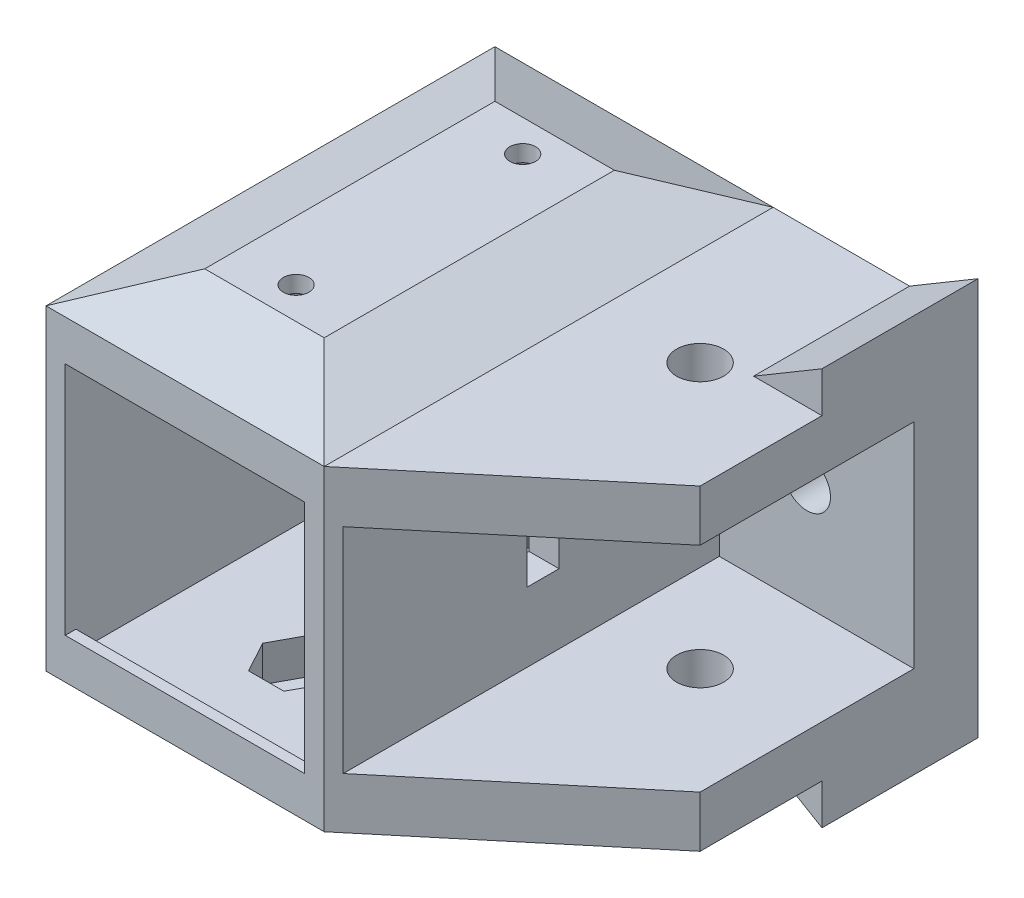
from build123d import *
from OCP.BRepFilletAPI import BRepFilletAPI_MakeChamfer

# Parameters (mm, degrees)
SKETCH1_R                  = 2.2
SKETCH1_W                  = 22.4
SKETCH1_H                  = 25.8
BOSS_EXTRUDE1_DEPTH        = 42
CUT_EXTRUDE1_DEPTH         = 69.433909723
BOSS_EXTRUDE2_DEPTH        = 14.6
SKETCH4_W                  = 36
SKETCH4_H                  = 20
CUT_EXTRUDE2_DEPTH         = 18.2
SKETCH5_R                  = 2.2
CUT_EXTRUDE3_DEPTH         = 71.161242862
SKETCH16_W                 = 26.03
SKETCH16_H                 = 42
BOSS_EXTRUDE6_DEPTH        = 3
CHAMFER1_SIZE              = 7.42526056
CHAMFER1_SIZE_2            = 3
CHAMFER1_OF_MIRROR7_SIZE   = 7.42526056
CHAMFER1_OF_MIRROR7_SIZE_2 = 3
CUT_EXTRUDE4_START         = -1.9
CUT_EXTRUDE4_DEPTH         = 3.35
SKETCH10_R                 = 1.2
CUT_EXTRUDE10_DEPTH        = 72.637978754
SKETCH13_W                 = 22.4
SKETCH13_H                 = 1.9
BOSS_EXTRUDE4_DEPTH        = 1
SKETCH14_W                 = 3
SKETCH14_H                 = 7
CUT_EXTRUDE11_DEPTH        = 2.8
SKETCH15_W                 = 22.4
SKETCH15_H                 = 1.9
BOSS_EXTRUDE5_DEPTH        = 1
MIRROR5_START              = -1.9
MIRROR5_COPY_1_DEPTH       = 3.35
SKETCH17_W                 = 13.216816462
SKETCH17_H                 = 5
SKETCH17_W_2               = 8
BOSS_EXTRUDE7_DEPTH        = 3.2
FILLET1_SIZE               = 3
FILLET1_SIZE_2             = 18
FILLET3_SIZE               = 5
FILLET3_SIZE_2             = 4


# Some blends are built 0.0001 mm under size
with BuildPart() as part:
    # Sketch1 → Boss-Extrude1 (new body)
    with BuildSketch(Plane.XY):
        Polygon((2, 0), (45.2, 0), (45.2, 29.6), (2, 29.6), (0, 29.6), (0, 27.6), (0, 2), (0, 0), align=None)
        with Locations(Location((35.2, 14.8, 0), (0, 0, 180))):
            Circle(SKETCH1_R, mode=Mode.SUBTRACT)
        with Locations((13, 14.8)):
            Rectangle(SKETCH1_W, SKETCH1_H, mode=Mode.SUBTRACT)
    extrude(amount=BOSS_EXTRUDE1_DEPTH)

    # Sketch2 → Cut-Extrude1 (cut, through all)
    with BuildSketch(Plane(origin=(0, 29.6, 0), x_dir=(1, 0, 0), z_dir=(0, 1, 0))):
        Polygon((45.2, -26), (26.03, -42), (45.2, -42), align=None)
    extrude(amount=-CUT_EXTRUDE1_DEPTH, mode=Mode.SUBTRACT)

    # Sketch3 → Boss-Extrude2 (add)
    with BuildSketch(Plane(origin=(0, 0, 0), x_dir=(-1, 0, 0), z_dir=(0, 0, -1))):
        Polygon((-38.8, 0), (-45.2, -3.8), (-45.2, 0), align=None)
        Polygon((-45.2, 29.6), (-38.8, 29.6), (-45.2, 33.4), align=None)
    extrude(amount=-BOSS_EXTRUDE2_DEPTH)

    # Sketch4 → Cut-Extrude2 (cut)
    with BuildSketch(Plane(origin=(45.2, 0, 0), x_dir=(0, 0, -1), z_dir=(1, 0, 0))):
        with Locations((-24, 14.8)):
            Rectangle(SKETCH4_W, SKETCH4_H)
    extrude(amount=-CUT_EXTRUDE2_DEPTH, mode=Mode.SUBTRACT)

    # Sketch5 → Cut-Extrude3 (cut, through all)
    with BuildSketch(Plane(origin=(0, 29.6, 0), x_dir=(1, 0, 0), z_dir=(0, 1, 0))):
        with Locations(Location((35.2, -16, 0), (0, 0, 270))):
            Circle(SKETCH5_R)
    extrude(amount=-CUT_EXTRUDE3_DEPTH, mode=Mode.SUBTRACT)

    # Sketch16 → Boss-Extrude6 (add)
    with BuildSketch(Plane(origin=(0, 29.6, 0), x_dir=(1, 0, 0), z_dir=(0, 1, 0))):
        with Locations((13.015, -21)):
            Rectangle(SKETCH16_W, SKETCH16_H)
    boss_extrude6 = extrude(amount=BOSS_EXTRUDE6_DEPTH)

    # Chamfer1
    chamfer1_edges_1 = [part.edges().sort_by_distance(p)[0] for p in [
        (13.015, 32.6, 42),
    ]]
    chamfer1_side_1 = [part.faces().sort_by_distance(p)[0] for p in [
        (13.015, 32.6, 41.94),
    ]]
    chamfer1_edges_2 = [part.edges().sort_by_distance(p)[0] for p in [
        (26.03, 32.6, 21),
    ]]
    chamfer1_side_2 = [part.faces().sort_by_distance(p)[0] for p in [
        (26.03, 32.54, 21),
    ]]
    chamfer1_edges_3 = [part.edges().sort_by_distance(p)[0] for p in [
        (13.015, 32.6, 0),
    ]]
    chamfer1_side_3 = [part.faces().sort_by_distance(p)[0] for p in [
        (13.015, 32.6, 0.06),
    ]]
    chamfer1_edges_4 = [part.edges().sort_by_distance(p)[0] for p in [
        (0, 32.6, 21),
    ]]
    chamfer1_side_4 = [part.faces().sort_by_distance(p)[0] for p in [
        (0.06, 32.6, 21),
    ]]
    chamfer1 = BRepFilletAPI_MakeChamfer(part.part.solid().wrapped)
    for e in chamfer1_edges_1:
        chamfer1.Add(CHAMFER1_SIZE - 0.0001, CHAMFER1_SIZE_2 - 0.0001, e.wrapped, chamfer1_side_1[0].wrapped)
    for e in chamfer1_edges_2:
        chamfer1.Add(CHAMFER1_SIZE_2 - 0.0001, CHAMFER1_SIZE - 0.0001, e.wrapped, chamfer1_side_2[0].wrapped)
    for e in chamfer1_edges_3:
        chamfer1.Add(CHAMFER1_SIZE - 0.0001, CHAMFER1_SIZE_2 - 0.0001, e.wrapped, chamfer1_side_3[0].wrapped)
    for e in chamfer1_edges_4:
        chamfer1.Add(CHAMFER1_SIZE - 0.0001, CHAMFER1_SIZE_2 - 0.0001, e.wrapped, chamfer1_side_4[0].wrapped)
    add(Compound.cast(chamfer1.Shape()), mode=Mode.REPLACE)  # a hair under: the kernel refuses the full size

    # Mirror7: Boss-Extrude6 across plane
    add(boss_extrude6.mirror(Plane(origin=(0, 14.8, 0), x_dir=(0, 0, 1), z_dir=(0, -1, 0))))

    # Chamfer1 of Mirror7
    chamfer1_of_mirror7_edges_1 = [part.edges().sort_by_distance(p)[0] for p in [
        (13.015, -3, 42),
    ]]
    chamfer1_of_mirror7_side_1 = [part.faces().sort_by_distance(p)[0] for p in [
        (13.015, -3, 41.94),
    ]]
    chamfer1_of_mirror7_edges_2 = [part.edges().sort_by_distance(p)[0] for p in [
        (26.03, -3, 21),
    ]]
    chamfer1_of_mirror7_side_2 = [part.faces().sort_by_distance(p)[0] for p in [
        (26.03, -2.94, 21),
    ]]
    chamfer1_of_mirror7_edges_3 = [part.edges().sort_by_distance(p)[0] for p in [
        (13.015, -3, 0),
    ]]
    chamfer1_of_mirror7_side_3 = [part.faces().sort_by_distance(p)[0] for p in [
        (13.015, -2.94, 0),
    ]]
    chamfer1_of_mirror7_edges_4 = [part.edges().sort_by_distance(p)[0] for p in [
        (0, -3, 21),
    ]]
    chamfer1_of_mirror7_side_4 = [part.faces().sort_by_distance(p)[0] for p in [
        (0.06, -3, 21),
    ]]
    chamfer1_of_mirror7 = BRepFilletAPI_MakeChamfer(part.part.solid().wrapped)
    for e in chamfer1_of_mirror7_edges_1:
        chamfer1_of_mirror7.Add(CHAMFER1_OF_MIRROR7_SIZE - 0.0001, CHAMFER1_OF_MIRROR7_SIZE_2 - 0.0001, e.wrapped, chamfer1_of_mirror7_side_1[0].wrapped)
    for e in chamfer1_of_mirror7_edges_2:
        chamfer1_of_mirror7.Add(CHAMFER1_OF_MIRROR7_SIZE_2 - 0.0001, CHAMFER1_OF_MIRROR7_SIZE - 0.0001, e.wrapped, chamfer1_of_mirror7_side_2[0].wrapped)
    for e in chamfer1_of_mirror7_edges_3:
        chamfer1_of_mirror7.Add(CHAMFER1_OF_MIRROR7_SIZE_2 - 0.0001, CHAMFER1_OF_MIRROR7_SIZE - 0.0001, e.wrapped, chamfer1_of_mirror7_side_3[0].wrapped)
    for e in chamfer1_of_mirror7_edges_4:
        chamfer1_of_mirror7.Add(CHAMFER1_OF_MIRROR7_SIZE - 0.0001, CHAMFER1_OF_MIRROR7_SIZE_2 - 0.0001, e.wrapped, chamfer1_of_mirror7_side_4[0].wrapped)
    add(Compound.cast(chamfer1_of_mirror7.Shape()), mode=Mode.REPLACE)  # a hair under: the kernel refuses the full size

    # Sketch6 → Cut-Extrude4 (cut)
    with BuildSketch(Plane(origin=(0, 29.6, 0), x_dir=(1, 0, 0), z_dir=(0, 1, 0)).offset(CUT_EXTRUDE4_START)):
        Polygon((11.35, -13.4), (9.775198425, -10.5), (11.35, -7.6), (14.65, -7.6), (16.244163906, -10.5), (14.65, -13.4), align=None)
    cut_extrude4 = extrude(amount=CUT_EXTRUDE4_DEPTH, mode=Mode.SUBTRACT)

    # Sketch10 → Cut-Extrude10 (cut, through all)
    with BuildSketch(Plane(origin=(0, 32.6, 0), x_dir=(1, 0, 0), z_dir=(0, 1, 0))):
        with Locations(Location((13, -10.4, 0), (0, 0, 270))):
            Circle(SKETCH10_R)
    cut_extrude10 = extrude(amount=-CUT_EXTRUDE10_DEPTH, mode=Mode.SUBTRACT)

    # Mirror4: Cut-Extrude4 across plane
    add(cut_extrude4.mirror(Plane(origin=(0, 14.8, 0), x_dir=(0, 0, 1), z_dir=(0, -1, 0))), mode=Mode.SUBTRACT)

    # Sketch13 → Boss-Extrude4 (add)
    with BuildSketch(Plane.XY.offset(42)):
        with Locations((13, 2.85)):
            Rectangle(SKETCH13_W, SKETCH13_H)
        with Locations((13, 26.75)):
            Rectangle(SKETCH13_W, SKETCH13_H)
    extrude(amount=-BOSS_EXTRUDE4_DEPTH)

    # Sketch14 → Cut-Extrude11 (cut)
    with BuildSketch(Plane(origin=(27, 0, 0), x_dir=(0, 0, -1), z_dir=(1, 0, 0))):
        with Locations((-9.5, 14.8)):
            Rectangle(SKETCH14_W, SKETCH14_H)
        with Locations((-22.5, 14.8)):
            Rectangle(SKETCH14_W, SKETCH14_H)
    extrude(amount=-CUT_EXTRUDE11_DEPTH, mode=Mode.SUBTRACT)

    # Sketch15 → Boss-Extrude5 (add)
    with BuildSketch(Plane(origin=(0, 0, 0), x_dir=(-1, 0, 0), z_dir=(0, 0, -1))):
        with Locations((-13, 2.85)):
            Rectangle(SKETCH15_W, SKETCH15_H)
        with Locations((-13, 26.75)):
            Rectangle(SKETCH15_W, SKETCH15_H)
    extrude(amount=-BOSS_EXTRUDE5_DEPTH)

    # Mirror5: Cut-Extrude4, Cut-Extrude10 across plane
    add(cut_extrude4.mirror(Plane.XY.offset(21)), mode=Mode.SUBTRACT)
    add(cut_extrude10.mirror(Plane.XY.offset(21)), mode=Mode.SUBTRACT)

    # Mirror5 copy 1 sketch → Mirror5 copy 1 (cut)
    with BuildSketch(Plane(origin=(0, 0, 42), x_dir=(1, 0, 0), z_dir=(0, -1, 0)).offset(MIRROR5_START)):
        Polygon((11.35, -13.4), (9.775198425, -10.5), (11.35, -7.6), (14.65, -7.6), (16.244163906, -10.5), (14.65, -13.4), align=None)
    extrude(amount=MIRROR5_COPY_1_DEPTH, mode=Mode.SUBTRACT)

    # Sketch17 → Boss-Extrude7 (add)
    with BuildSketch(Plane.ZY.offset(-24.2)):
        with Locations((30.608408231, 14.8)):
            Rectangle(SKETCH17_W, SKETCH17_H)
        with Locations((4, 14.8)):
            Rectangle(SKETCH17_W_2, SKETCH17_H)
    extrude(amount=BOSS_EXTRUDE7_DEPTH)

    # Fillet1
    # a fillet whose section is not a circle: 18, 3 mm, written as the material it takes off along each edge
    with BuildSketch(Plane(origin=(21, 12.3, 24), x_dir=(1, 0, 0), z_dir=(0, 1, 0))) as fillet1_piece_1:
        with BuildLine():
            Bezier((FILLET1_SIZE, 0), (0, 0), (0, -FILLET1_SIZE_2), weights=[1, 0.538461538, 1])
            Line((0, -FILLET1_SIZE_2), (0, 0))
            Line((0, 0), (FILLET1_SIZE, 0))
        make_face()
    extrude(amount=5, mode=Mode.SUBTRACT)

    # Fillet2
    # a fillet whose section is not a circle: 1 mm, written as the material it takes off along each edge
    with BuildSketch(Plane(origin=(21.159285498, 19.997028117, 37.216816462), x_dir=(1, 0, 0), z_dir=(0, -1, 0))) as fillet2_piece_1:
        with BuildLine():
            Bezier((1.072400011, 0), (-0.006916058, 0), (0.075305906, -1.076179691), weights=[1, 1, 1])
            ThreePointArc((0.075305906, -1.076179691), (0.035933118, -0.538210194), (0, 0))
            Line((0, 0), (1.072400011, 0))
        make_face()
    extrude(amount=10.394056235, mode=Mode.SUBTRACT)

    # Fillet3
    # a fillet whose section is not a circle: 5, 4 mm, written as the material it takes off along each edge
    with BuildSketch(Plane(origin=(21, -0.2, 8), x_dir=(0, 0, -1), z_dir=(0, 1, 0))) as fillet3_piece_1_section:
        with BuildLine():
            Bezier((FILLET3_SIZE, 0), (0, 0), (0, -FILLET3_SIZE_2), weights=[1, 0.538461538, 1])
            Line((0, -FILLET3_SIZE_2), (0, 0))
            Line((0, 0), (FILLET3_SIZE, 0))
        make_face()
    fillet3_piece_1 = extrude(amount=30, mode=Mode.PRIVATE)
    fillet3_piece_1 = split(fillet3_piece_1, bisect_by=Plane(origin=(21, 18.3, 8), z_dir=(0, -1, 0)), keep=Keep.TOP, mode=Mode.PRIVATE)
    fillet3_piece_1 = split(fillet3_piece_1, bisect_by=Plane(origin=(21, 11.3, 8), z_dir=(0, 1, 0)), keep=Keep.TOP, mode=Mode.PRIVATE)
    add(fillet3_piece_1, mode=Mode.SUBTRACT)


solid = part.part
